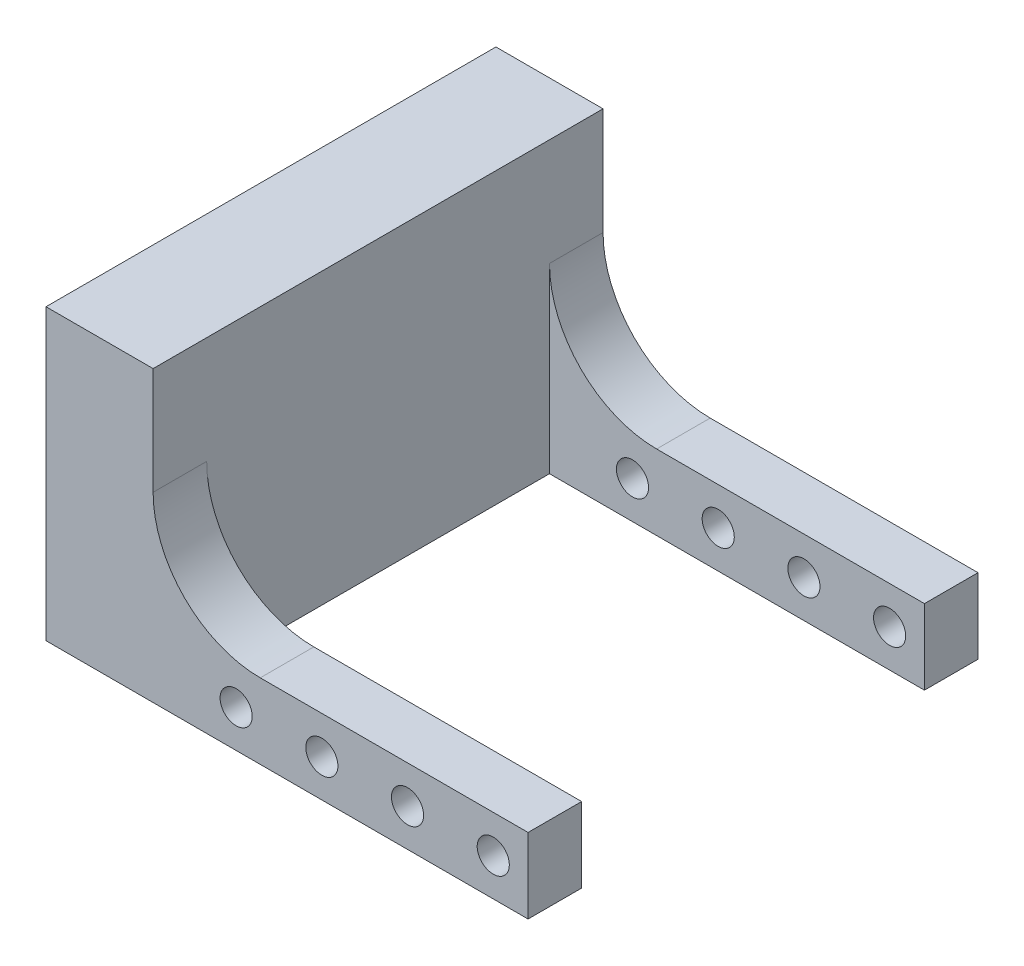
from build123d import *

# Parameters (mm, degrees)
BOSS_EXTRU_1_DEPTH      = 42
ESQUISSE3_W             = 35
ESQUISSE3_H             = 32
ENL_V_MAT_EXTRU_2_DEPTH = 59.215118311
ESQUISSE2_R             = 1.5
ENL_V_MAT_EXTRU_3_DEPTH = 61.975404878
CONG_1_R                = 10


with BuildPart() as part:
    # Esquisse1 → Boss.-Extru.1 (new body)
    with BuildSketch(Plane.XY):
        Polygon((0, 7), (0, 27), (-10, 27), (-10, 0), (0, 0), (35, 0), (35, 7), align=None)
    extrude(amount=BOSS_EXTRU_1_DEPTH)

    # Esquisse3 → Enlèv. mat.-Extru.2 (cut, through all)
    with BuildSketch(Plane(origin=(0, 7, 0), x_dir=(1, 0, 0), z_dir=(0, 1, 0))):
        with Locations((17.5, -21)):
            Rectangle(ESQUISSE3_W, ESQUISSE3_H)
    extrude(amount=-ENL_V_MAT_EXTRU_2_DEPTH, mode=Mode.SUBTRACT)

    # Esquisse2 → Enlèv. mat.-Extru.3 (cut, through all)
    with BuildSketch(Plane.XY.offset(42)):
        with Locations((31.75, 3.5)):
            Circle(ESQUISSE2_R)
        with Locations((23.75, 3.5)):
            Circle(ESQUISSE2_R)
        with Locations((15.75, 3.5)):
            Circle(ESQUISSE2_R)
        with Locations((7.75, 3.5)):
            Circle(ESQUISSE2_R)
    extrude(amount=-ENL_V_MAT_EXTRU_3_DEPTH, mode=Mode.SUBTRACT)

    # Congé1
    cong_1_edges = [part.edges().sort_by_distance(p)[0] for p in [
        (0, 7, 2.5),
        (0, 7, 39.5),
    ]]
    fillet(cong_1_edges, radius=CONG_1_R)


solid = part.part
